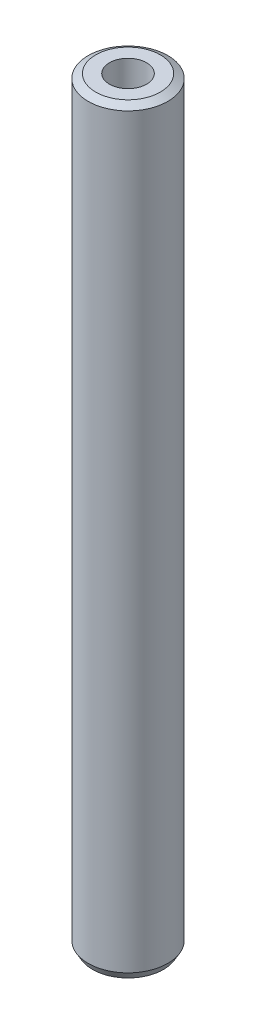
from build123d import *
from OCP.BRepFilletAPI import BRepFilletAPI_MakeChamfer

# Parameters (mm, degrees)
SKETCH1_R           = 22.5
BOSS_EXTRUDE1_DEPTH = 428.811424189
SKETCH2_R           = 10.526477732
CUT_EXTRUDE1_DEPTH  = 430.990392352
CHAMFER1_SIZE       = 2.44560932
CHAMFER1_SIZE2      = 4.235919598


with BuildPart() as part:
    # Sketch1 → Boss-Extrude1 (new body)
    with BuildSketch(Plane(origin=(0, 0, 0), x_dir=(1, 0, 0), z_dir=(0, 1, 0))):
        Circle(SKETCH1_R)
    extrude(amount=BOSS_EXTRUDE1_DEPTH)

    # Sketch2 → Cut-Extrude1 (cut, through all)
    with BuildSketch(Plane(origin=(0, 0, 0), x_dir=(1, 0, 0), z_dir=(0, 1, 0))):
        Circle(SKETCH2_R)
    extrude(amount=CUT_EXTRUDE1_DEPTH, mode=Mode.SUBTRACT)

    # Chamfer1: one chamfer whose edges measure the first distance from different faces: ONE call of the kernel's chamfer builder (chamfer() names one face for all edges)
    chamfer1_edges_1 = [part.edges().sort_by_distance(p)[0] for p in [
        (-22.5, 428.811424189, 0),
    ]]
    chamfer1_side_1 = [part.faces().sort_by_distance(p)[0] for p in [
        (-22.5, 214.405712095, 0),
    ]]
    chamfer1_edges_2 = [part.edges().sort_by_distance(p)[0] for p in [
        (-22.5, 0, 0),
    ]]
    chamfer1_side_2 = [part.faces().sort_by_distance(p)[0] for p in [
        (-21.863603897, 0, 0),
    ]]
    chamfer1 = BRepFilletAPI_MakeChamfer(part.part.solid().wrapped)
    for e in chamfer1_edges_1:
        chamfer1.Add(CHAMFER1_SIZE, CHAMFER1_SIZE2, e.wrapped, chamfer1_side_1[0].wrapped)  # the first distance lies on this face
    for e in chamfer1_edges_2:
        chamfer1.Add(CHAMFER1_SIZE, CHAMFER1_SIZE2, e.wrapped, chamfer1_side_2[0].wrapped)  # the first distance lies on this face
    add(Compound.cast(chamfer1.Shape()), mode=Mode.REPLACE)


solid = part.part
